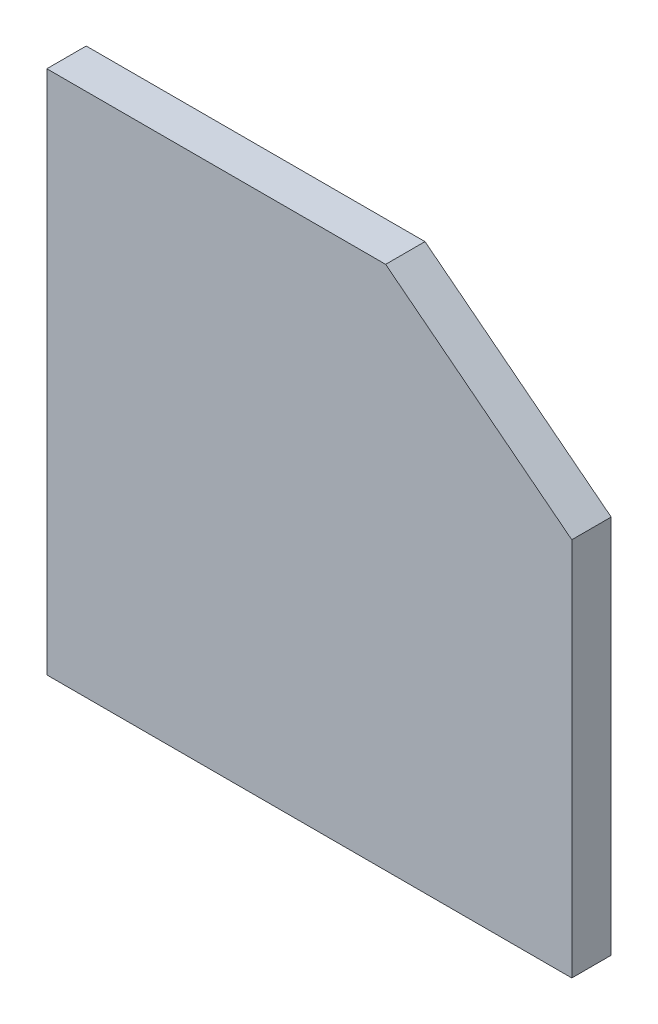
from build123d import *

# Parameters (mm, degrees)
BOSS_EXTRUDE1_DEPTH = 3


with BuildPart() as part:
    # Sketch1 → Boss-Extrude1 (new body)
    with BuildSketch(Plane.XY):
        Polygon((40, 28.918093444), (25.815806435, 40), (0, 40), (0, 0), (40, 0), align=None)
    extrude(amount=BOSS_EXTRUDE1_DEPTH)


solid = part.part
